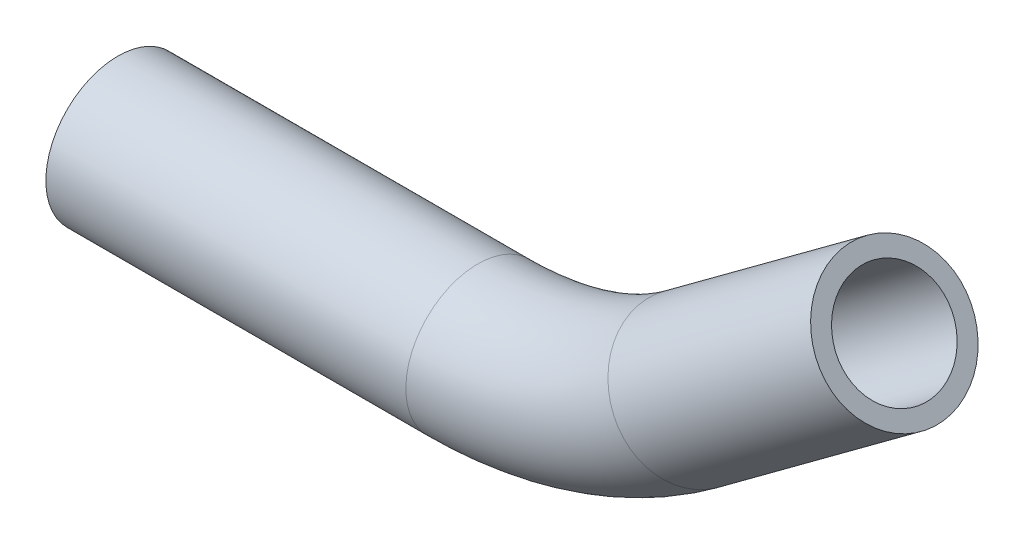
from build123d import *

# Parameters (mm, degrees)
SKETCH_2_R   = 4
SKETCH_2_R_2 = 3


with BuildPart() as part:
    # По траектории1: sweep along a path in Эскиз1
    with BuildLine(Plane.XY) as sweep_1_path:
        Line((0, 0), (20, 0))
        ThreePointArc((20, 0), (26.254925181, 1.003265781), (31.882315122, 3.912408902))
        Line((31.882315122, 3.912408902), (43.143628891, 12.230029487))
    # Эскиз2 → По траектории1 (sweep)
    with BuildSketch(Plane(origin=(0, 0, 0), x_dir=(0, 0, -1), z_dir=(1, 0, 0))):
        Circle(SKETCH_2_R)
        Circle(SKETCH_2_R_2, mode=Mode.SUBTRACT)
    sweep(path=sweep_1_path.line)


solid = part.part
